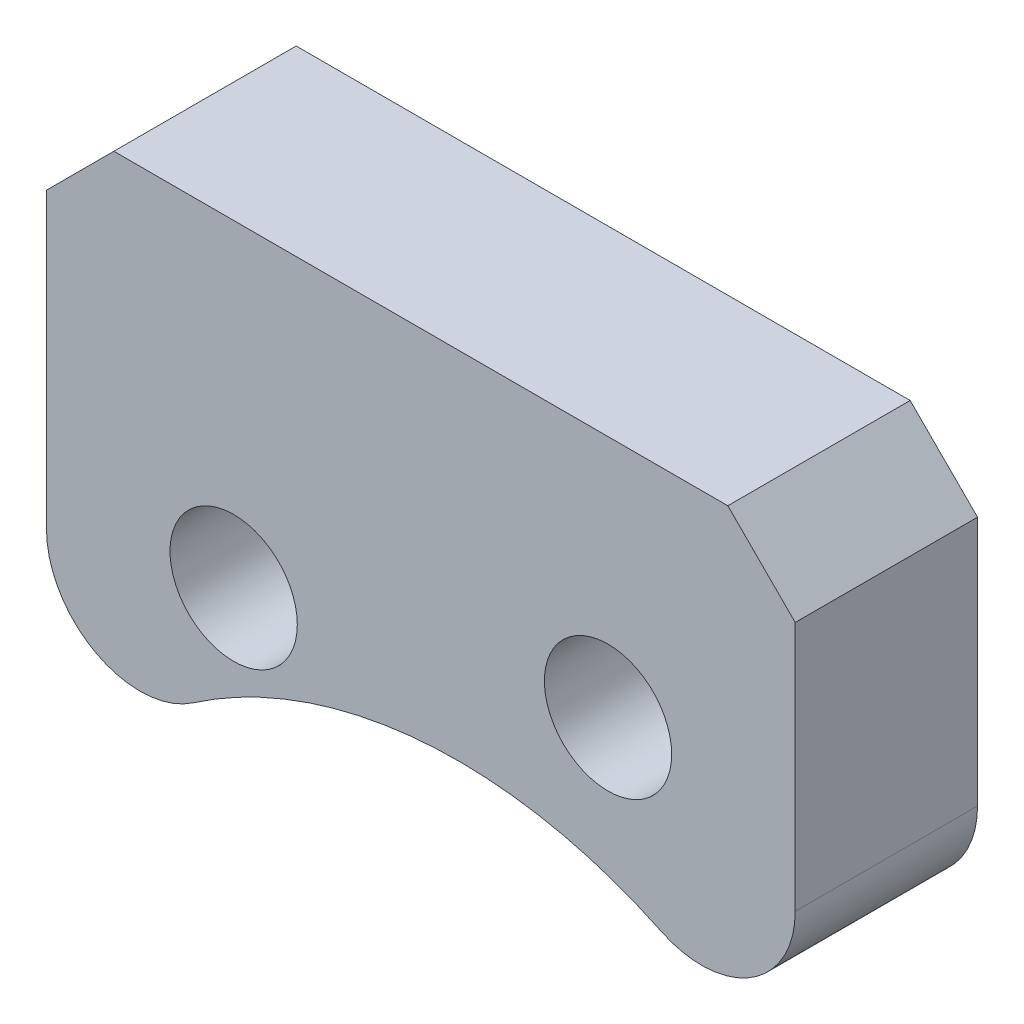
from build123d import *

# Parameters (mm, degrees)
SKETCH1_R           = 1.7
BOSS_EXTRUDE1_DEPTH = 4.87
CHAMFER1_SIZE       = 1.8
FILLET1_R           = 2.5


with BuildPart() as part:
    # Sketch1 → Boss-Extrude1 (new body)
    with BuildSketch(Plane.XY):
        with BuildLine():
            Line((-20, 0), (0, 0))
            Line((0, 0), (0, -13.325324214))
            ThreePointArc((0, -13.325324214), (-10.695135114, -9.61547268), (-20, -16.062828956))
            Line((-20, -16.062828956), (-20, 0))
        make_face()
        with Locations((-15, -8.5)):
            Circle(SKETCH1_R, mode=Mode.SUBTRACT)
        with Locations((-5, -6.5)):
            Circle(SKETCH1_R, mode=Mode.SUBTRACT)
    extrude(amount=BOSS_EXTRUDE1_DEPTH)

    # Chamfer1
    chamfer1_edges = [part.edges().sort_by_distance(p)[0] for p in [
        (0, 0, 2.435),
        (-20, 0, 2.435),
    ]]
    chamfer(chamfer1_edges, length=CHAMFER1_SIZE)

    # Fillet1
    fillet1_edges = [part.edges().sort_by_distance(p)[0] for p in [
        (0, -13.325324214, 2.435),
        (-20, -16.062828956, 2.435),
    ]]
    fillet(fillet1_edges, radius=FILLET1_R)


solid = part.part
